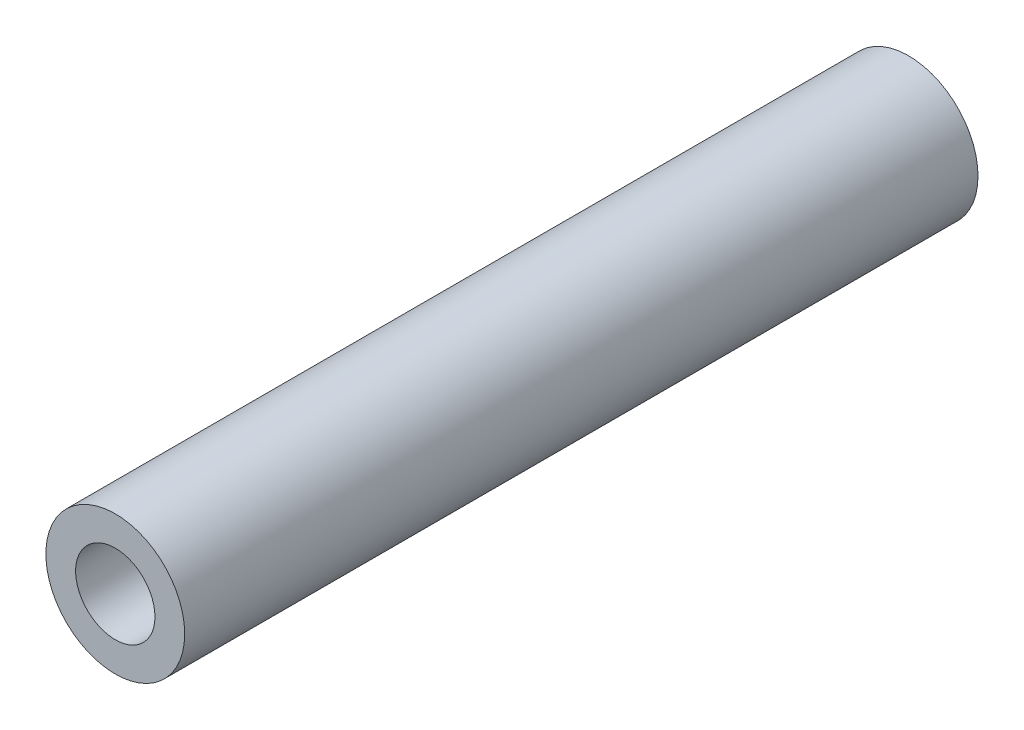
from build123d import *

# Parameters (mm, degrees)
SKETCH_1_R      = 3.5
SKETCH_1_R_2    = 2
EXTRUDE_1_DEPTH = 40


with BuildPart() as part:
    # 草图1 → 凸台-拉伸1 (new body)
    with BuildSketch(Plane.XY):
        Circle(SKETCH_1_R)
        Circle(SKETCH_1_R_2, mode=Mode.SUBTRACT)
    extrude(amount=EXTRUDE_1_DEPTH)


solid = part.part
